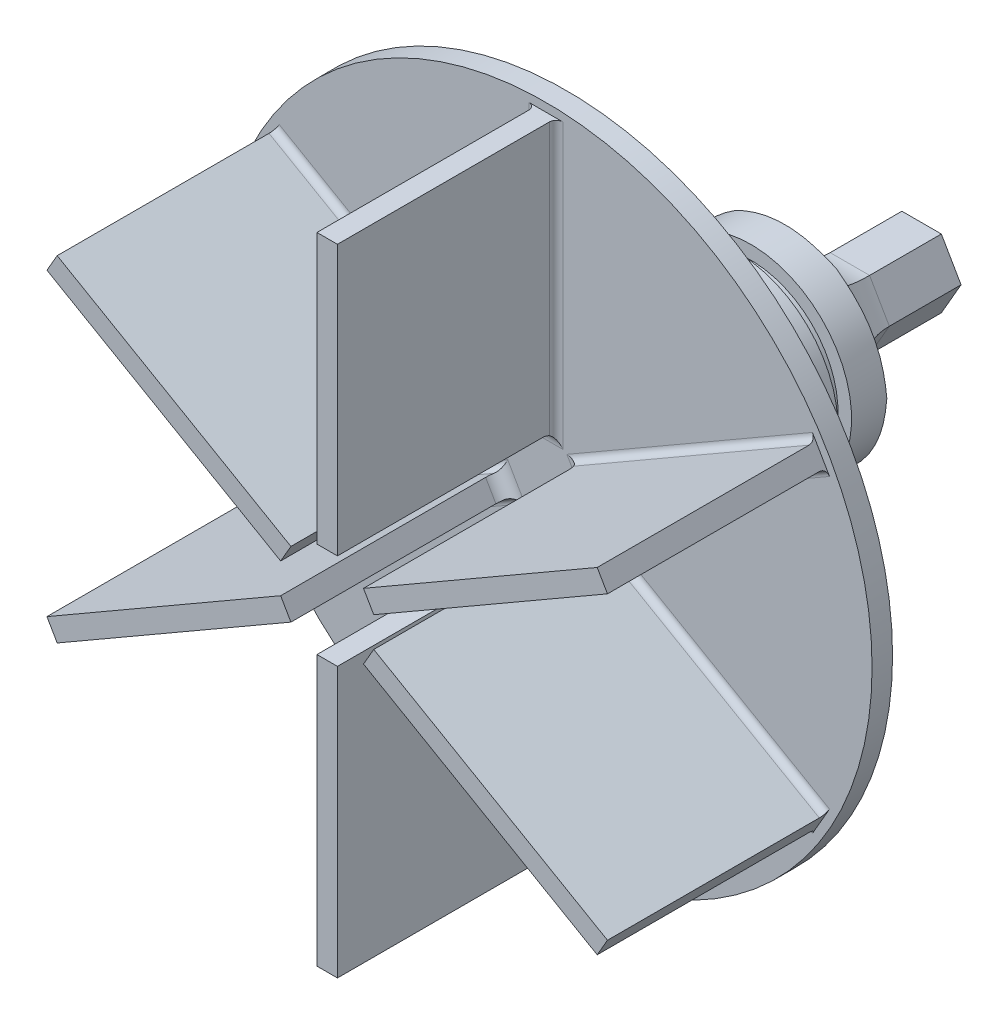
from build123d import *

# Parameters (mm, degrees)
ESBO_O1_R                = 14.75
RESSALTO_EXTRUS_O1_DEPTH = 32
ESBO_O2_R                = 47.75
RESSALTO_EXTRUS_O2_DEPTH = 3
ESBO_O3_W                = 3
ESBO_O3_H                = 39.5
RESSALTO_EXTRUS_O3_DEPTH = 32
FILETE1_R                = 1
FILETE2_R                = 2
ESBO_O4_W                = 2
ESBO_O4_H                = 2
RESSALTO_EXTRUS_O4_DEPTH = 20
FILETE3_R                = 9.5


with BuildPart() as part:
    # Esboço1 → Ressalto-extrusão1 (new body)
    with BuildSketch(Plane.XY):
        Circle(ESBO_O1_R)
    extrude(amount=RESSALTO_EXTRUS_O1_DEPTH)

    # Esboço4 → Corte-Revolução1 (revolve, cut)
    with BuildSketch(Plane(origin=(0, 0, 0), x_dir=(0, 0, -1), z_dir=(1, 0, 0)), mode=Mode.PRIVATE) as corte_revolu_o1_sk:
        with Locations((-6, 13.75)):
            Rectangle(ESBO_O4_W, ESBO_O4_H)
    revolve(corte_revolu_o1_sk.sketch.rotate(Axis((0, 0, 0), (0, 0, 1)), 90), axis=Axis((0, 0, 0), (0, 0, 1)), mode=Mode.SUBTRACT)

    # Esboço5 → Ressalto-extrusão4 (add)
    with BuildSketch(Plane(origin=(0, 0, 0), x_dir=(-1, 0, 0), z_dir=(0, 0, -1))):
        Polygon((5.773502692, 0), (2.886751346, 5), (-2.886751346, 5), (-5.773502692, 0), (-2.886751346, -5), (2.886751346, -5), align=None)
    extrude(amount=RESSALTO_EXTRUS_O4_DEPTH)

    # Filete3
    # the kernel refuses this fillet: 9.5 mm, written as the material it adds along each edge
    with BuildSketch(Plane(origin=(8.988248654, -25.56810334, 0), x_dir=(-0.8660254037844386, -0.5, 0), z_dir=(-0.5, 0.8660254037844387, 0))) as filete3_piece_1_section:
        with BuildLine():
            CenterArc((FILETE3_R, -FILETE3_R), FILETE3_R, 90, 90)
            Line((0, -FILETE3_R), (0, 0))
            Line((0, 0), (FILETE3_R, 0))
        make_face()
    filete3_piece_1 = extrude(amount=53.273502692, mode=Mode.PRIVATE)
    filete3_piece_1 = split(filete3_piece_1, bisect_by=Plane(origin=(-5.234241446, -5, -2.859682806), z_dir=(0, 1, 0)), keep=Keep.TOP, mode=Mode.PRIVATE)
    filete3_piece_1 = split(filete3_piece_1, bisect_by=Plane(origin=(-6.947247742, -2.032986062, -2.859682806), z_dir=(0.8660254037844387, -0.5, 0)), keep=Keep.TOP, mode=Mode.PRIVATE)
    add(filete3_piece_1)
    with BuildSketch(Plane(origin=(8.988248654, -25.56810334, 0), x_dir=(-0.8660254037844386, -0.5, 0), z_dir=(-0.5, 0.8660254037844387, 0))) as filete3_piece_2_section:
        with BuildLine():
            CenterArc((FILETE3_R, -FILETE3_R), FILETE3_R, 90, 90)
            Line((0, -FILETE3_R), (0, 0))
            Line((0, 0), (FILETE3_R, 0))
        make_face()
    filete3_piece_2 = extrude(amount=53.273502692, mode=Mode.PRIVATE)
    filete3_piece_2 = split(filete3_piece_2, bisect_by=Plane(origin=(-10.744786352, -5, -0.059997922), z_dir=(0, -1, 0)), keep=Keep.TOP, mode=Mode.PRIVATE)
    filete3_piece_2 = split(filete3_piece_2, bisect_by=Plane(origin=(-9.702520195, -6.805257939, -0.059997922), z_dir=(-0.8660254037844387, 0.5, 0)), keep=Keep.TOP, mode=Mode.PRIVATE)
    add(filete3_piece_2)
    with BuildSketch(Plane(origin=(-17.648502692, -20.56810334, 0), x_dir=(-0.8660254037844386, 0.4999999999999999, 0), z_dir=(0.5, 0.8660254037844387, 0))) as filete3_piece_3_section:
        with BuildLine():
            CenterArc((FILETE3_R, -FILETE3_R), FILETE3_R, 90, 90)
            Line((0, -FILETE3_R), (0, 0))
            Line((0, 0), (FILETE3_R, 0))
        make_face()
    filete3_piece_3 = extrude(amount=53.273502692, mode=Mode.PRIVATE)
    filete3_piece_3 = split(filete3_piece_3, bisect_by=Plane(origin=(-6.947247742, 2.032986062, -2.859682806), z_dir=(0.8660254037844387, 0.5, 0)), keep=Keep.TOP, mode=Mode.PRIVATE)
    filete3_piece_3 = split(filete3_piece_3, bisect_by=Plane(origin=(-5.234241446, 5, -2.859682806), z_dir=(0, -1, 0)), keep=Keep.TOP, mode=Mode.PRIVATE)
    add(filete3_piece_3)
    with BuildSketch(Plane(origin=(-17.648502692, -20.56810334, 0), x_dir=(-0.8660254037844386, 0.4999999999999999, 0), z_dir=(0.5, 0.8660254037844387, 0))) as filete3_piece_4_section:
        with BuildLine():
            CenterArc((FILETE3_R, -FILETE3_R), FILETE3_R, 90, 90)
            Line((0, -FILETE3_R), (0, 0))
            Line((0, 0), (FILETE3_R, 0))
        make_face()
    filete3_piece_4 = extrude(amount=53.273502692, mode=Mode.PRIVATE)
    filete3_piece_4 = split(filete3_piece_4, bisect_by=Plane(origin=(-9.702520195, 6.805257939, -0.059997922), z_dir=(-0.8660254037844387, -0.5, 0)), keep=Keep.TOP, mode=Mode.PRIVATE)
    filete3_piece_4 = split(filete3_piece_4, bisect_by=Plane(origin=(-10.744786352, 5, -0.059997922), z_dir=(0, 1, 0)), keep=Keep.TOP, mode=Mode.PRIVATE)
    add(filete3_piece_4)
    with BuildSketch(Plane(origin=(-26.636751346, 5, 0), x_dir=(0, 1, 0), z_dir=(1, 0, 0))) as filete3_piece_5_section:
        with BuildLine():
            CenterArc((FILETE3_R, -FILETE3_R), FILETE3_R, 90, 90)
            Line((0, -FILETE3_R), (0, 0))
            Line((0, 0), (FILETE3_R, 0))
        make_face()
    filete3_piece_5 = extrude(amount=53.273502692, mode=Mode.PRIVATE)
    filete3_piece_5 = split(filete3_piece_5, bisect_by=Plane(origin=(1.713006296, 7.032986062, -2.859682806), z_dir=(-0.8660254037844386, -0.5000000000000002, 0)), keep=Keep.TOP, mode=Mode.PRIVATE)
    filete3_piece_5 = split(filete3_piece_5, bisect_by=Plane(origin=(-1.713006296, 7.032986062, -2.859682806), z_dir=(0.8660254037844387, -0.5, 0)), keep=Keep.TOP, mode=Mode.PRIVATE)
    add(filete3_piece_5)
    with BuildSketch(Plane(origin=(-26.636751346, 5, 0), x_dir=(0, 1, 0), z_dir=(1, 0, 0))) as filete3_piece_6_section:
        with BuildLine():
            CenterArc((FILETE3_R, -FILETE3_R), FILETE3_R, 90, 90)
            Line((0, -FILETE3_R), (0, 0))
            Line((0, 0), (FILETE3_R, 0))
        make_face()
    filete3_piece_6 = extrude(amount=53.273502692, mode=Mode.PRIVATE)
    filete3_piece_6 = split(filete3_piece_6, bisect_by=Plane(origin=(-1.042266157, 11.805257939, -0.059997922), z_dir=(0.8660254037844386, 0.5000000000000002, 0)), keep=Keep.TOP, mode=Mode.PRIVATE)
    filete3_piece_6 = split(filete3_piece_6, bisect_by=Plane(origin=(1.042266157, 11.805257939, -0.059997922), z_dir=(-0.8660254037844387, 0.5, 0)), keep=Keep.TOP, mode=Mode.PRIVATE)
    add(filete3_piece_6)
    with BuildSketch(Plane(origin=(-8.988248654, 25.56810334, 0), x_dir=(0.8660254037844384, 0.5000000000000001, 0), z_dir=(0.5000000000000002, -0.8660254037844386, 0))) as filete3_piece_7_section:
        with BuildLine():
            CenterArc((FILETE3_R, -FILETE3_R), FILETE3_R, 90, 90)
            Line((0, -FILETE3_R), (0, 0))
            Line((0, 0), (FILETE3_R, 0))
        make_face()
    filete3_piece_7 = extrude(amount=53.273502692, mode=Mode.PRIVATE)
    filete3_piece_7 = split(filete3_piece_7, bisect_by=Plane(origin=(6.947247742, 2.032986062, -2.859682806), z_dir=(-0.8660254037844387, 0.5, 0)), keep=Keep.TOP, mode=Mode.PRIVATE)
    filete3_piece_7 = split(filete3_piece_7, bisect_by=Plane(origin=(5.234241446, 5, -2.859682806), z_dir=(0, -1, 0)), keep=Keep.TOP, mode=Mode.PRIVATE)
    add(filete3_piece_7)
    with BuildSketch(Plane(origin=(-8.988248654, 25.56810334, 0), x_dir=(0.8660254037844384, 0.5000000000000001, 0), z_dir=(0.5000000000000002, -0.8660254037844386, 0))) as filete3_piece_8_section:
        with BuildLine():
            CenterArc((FILETE3_R, -FILETE3_R), FILETE3_R, 90, 90)
            Line((0, -FILETE3_R), (0, 0))
            Line((0, 0), (FILETE3_R, 0))
        make_face()
    filete3_piece_8 = extrude(amount=53.273502692, mode=Mode.PRIVATE)
    filete3_piece_8 = split(filete3_piece_8, bisect_by=Plane(origin=(9.702520195, 6.805257939, -0.059997922), z_dir=(0.8660254037844387, -0.5, 0)), keep=Keep.TOP, mode=Mode.PRIVATE)
    filete3_piece_8 = split(filete3_piece_8, bisect_by=Plane(origin=(10.744786352, 5, -0.059997922), z_dir=(0, 1, 0)), keep=Keep.TOP, mode=Mode.PRIVATE)
    add(filete3_piece_8)
    with BuildSketch(Plane(origin=(17.648502692, 20.56810334, 0), x_dir=(0.8660254037844386, -0.5, 0), z_dir=(-0.5, -0.8660254037844387, 0))) as filete3_piece_9_section:
        with BuildLine():
            CenterArc((FILETE3_R, -FILETE3_R), FILETE3_R, 90, 90)
            Line((0, -FILETE3_R), (0, 0))
            Line((0, 0), (FILETE3_R, 0))
        make_face()
    filete3_piece_9 = extrude(amount=53.273502692, mode=Mode.PRIVATE)
    filete3_piece_9 = split(filete3_piece_9, bisect_by=Plane(origin=(5.234241446, -5, -2.859682806), z_dir=(0, 1, 0)), keep=Keep.TOP, mode=Mode.PRIVATE)
    filete3_piece_9 = split(filete3_piece_9, bisect_by=Plane(origin=(6.947247742, -2.032986062, -2.859682806), z_dir=(-0.8660254037844386, -0.5000000000000002, 0)), keep=Keep.TOP, mode=Mode.PRIVATE)
    add(filete3_piece_9)
    with BuildSketch(Plane(origin=(17.648502692, 20.56810334, 0), x_dir=(0.8660254037844386, -0.5, 0), z_dir=(-0.5, -0.8660254037844387, 0))) as filete3_piece_10_section:
        with BuildLine():
            CenterArc((FILETE3_R, -FILETE3_R), FILETE3_R, 90, 90)
            Line((0, -FILETE3_R), (0, 0))
            Line((0, 0), (FILETE3_R, 0))
        make_face()
    filete3_piece_10 = extrude(amount=53.273502692, mode=Mode.PRIVATE)
    filete3_piece_10 = split(filete3_piece_10, bisect_by=Plane(origin=(10.744786352, -5, -0.059997922), z_dir=(0, -1, 0)), keep=Keep.TOP, mode=Mode.PRIVATE)
    filete3_piece_10 = split(filete3_piece_10, bisect_by=Plane(origin=(9.702520195, -6.805257939, -0.059997922), z_dir=(0.8660254037844386, 0.5000000000000002, 0)), keep=Keep.TOP, mode=Mode.PRIVATE)
    add(filete3_piece_10)
    with BuildSketch(Plane(origin=(26.636751346, -5, 0), x_dir=(0, -1, 0), z_dir=(-1, 0, 0))) as filete3_piece_11_section:
        with BuildLine():
            CenterArc((FILETE3_R, -FILETE3_R), FILETE3_R, 90, 90)
            Line((0, -FILETE3_R), (0, 0))
            Line((0, 0), (FILETE3_R, 0))
        make_face()
    filete3_piece_11 = extrude(amount=53.273502692, mode=Mode.PRIVATE)
    filete3_piece_11 = split(filete3_piece_11, bisect_by=Plane(origin=(-1.713006296, -7.032986062, -2.859682806), z_dir=(0.8660254037844387, 0.5, 0)), keep=Keep.TOP, mode=Mode.PRIVATE)
    filete3_piece_11 = split(filete3_piece_11, bisect_by=Plane(origin=(1.713006296, -7.032986062, -2.859682806), z_dir=(-0.8660254037844387, 0.5, 0)), keep=Keep.TOP, mode=Mode.PRIVATE)
    add(filete3_piece_11)
    with BuildSketch(Plane(origin=(26.636751346, -5, 0), x_dir=(0, -1, 0), z_dir=(-1, 0, 0))) as filete3_piece_12_section:
        with BuildLine():
            CenterArc((FILETE3_R, -FILETE3_R), FILETE3_R, 90, 90)
            Line((0, -FILETE3_R), (0, 0))
            Line((0, 0), (FILETE3_R, 0))
        make_face()
    filete3_piece_12 = extrude(amount=53.273502692, mode=Mode.PRIVATE)
    filete3_piece_12 = split(filete3_piece_12, bisect_by=Plane(origin=(1.042266157, -11.805257939, -0.059997922), z_dir=(-0.8660254037844387, -0.5, 0)), keep=Keep.TOP, mode=Mode.PRIVATE)
    filete3_piece_12 = split(filete3_piece_12, bisect_by=Plane(origin=(-1.042266157, -11.805257939, -0.059997922), z_dir=(0.8660254037844387, -0.5, 0)), keep=Keep.TOP, mode=Mode.PRIVATE)
    add(filete3_piece_12)
    with BuildSketch(Plane(origin=(8.988248654, -25.56810334, 0), x_dir=(-0.8660254037844386, -0.5, 0), z_dir=(-0.5, 0.8660254037844387, 0))) as filete3_piece_13a_section:
        with BuildLine():
            CenterArc((FILETE3_R, -FILETE3_R), FILETE3_R, 90, 90)
            Line((0, -FILETE3_R), (0, 0))
            Line((0, 0), (FILETE3_R, 0))
        make_face()
    filete3_piece_13a = extrude(amount=53.273502692, mode=Mode.PRIVATE)
    filete3_piece_13a = filete3_piece_13a & Plane(origin=(0, 0, -2.20843227), x_dir=(1, 0, 0), z_dir=(0, 0, -1)) * Cylinder(14.75, 145, mode=Mode.PRIVATE)
    filete3_piece_13a = split(filete3_piece_13a, bisect_by=Plane(origin=(-2.397734967, -5, -2.20843227), z_dir=(0, -1, 0)), keep=Keep.TOP, mode=Mode.PRIVATE)
    filete3_piece_13a = split(filete3_piece_13a, bisect_by=Plane(origin=(-9.188049027, -5.914167737, -2.20843227), z_dir=(0.8660254037844387, -0.5, 0)), keep=Keep.TOP, mode=Mode.PRIVATE)
    with BuildSketch(Plane(origin=(26.636751346, -5, 0), x_dir=(0, -1, 0), z_dir=(-1, 0, 0))) as filete3_piece_13b_section:
        with BuildLine():
            CenterArc((FILETE3_R, -FILETE3_R), FILETE3_R, 90, 90)
            Line((0, -FILETE3_R), (0, 0))
            Line((0, 0), (FILETE3_R, 0))
        make_face()
    filete3_piece_13b = extrude(amount=53.273502692, mode=Mode.PRIVATE)
    filete3_piece_13b = filete3_piece_13b & Plane(origin=(0, 0, -2.208424307), x_dir=(1, 0, 0), z_dir=(0, 0, -1)) * Cylinder(14.75, 145, mode=Mode.PRIVATE)
    filete3_piece_13b = split(filete3_piece_13b, bisect_by=Plane(origin=(-3.131267274, -4.57648599, -2.208424307), z_dir=(-0.8660254037844387, -0.5, 0)), keep=Keep.TOP, mode=Mode.PRIVATE)
    filete3_piece_13b = split(filete3_piece_13b, bisect_by=Plane(origin=(-0.527786364, -10.914152797, -2.208424307), z_dir=(-0.8660254037844387, 0.5, 0)), keep=Keep.TOP, mode=Mode.PRIVATE)
    filete3_piece_13 = filete3_piece_13a & filete3_piece_13b
    add(filete3_piece_13)
    with BuildSketch(Plane(origin=(8.988248654, -25.56810334, 0), x_dir=(-0.8660254037844386, -0.5, 0), z_dir=(-0.5, 0.8660254037844387, 0))) as filete3_piece_14a_section:
        with BuildLine():
            CenterArc((FILETE3_R, -FILETE3_R), FILETE3_R, 90, 90)
            Line((0, -FILETE3_R), (0, 0))
            Line((0, 0), (FILETE3_R, 0))
        make_face()
    filete3_piece_14a = extrude(amount=53.273502692, mode=Mode.PRIVATE)
    filete3_piece_14a = filete3_piece_14a & Plane(origin=(0, 0, -2.208424307), x_dir=(1, 0, 0), z_dir=(0, 0, -1)) * Cylinder(14.75, 145, mode=Mode.PRIVATE)
    filete3_piece_14a = split(filete3_piece_14a, bisect_by=Plane(origin=(-9.715826765, -5, -2.208424307), z_dir=(0, 1, 0)), keep=Keep.TOP, mode=Mode.PRIVATE)
    filete3_piece_14a = split(filete3_piece_14a, bisect_by=Plane(origin=(-5.528986764, 0.42351401, -2.208424307), z_dir=(-0.8660254037844387, 0.5, 0)), keep=Keep.TOP, mode=Mode.PRIVATE)
    with BuildSketch(Plane(origin=(-17.648502692, -20.56810334, 0), x_dir=(-0.8660254037844386, 0.4999999999999999, 0), z_dir=(0.5, 0.8660254037844387, 0))) as filete3_piece_14b_section:
        with BuildLine():
            CenterArc((FILETE3_R, -FILETE3_R), FILETE3_R, 90, 90)
            Line((0, -FILETE3_R), (0, 0))
            Line((0, 0), (FILETE3_R, 0))
        make_face()
    filete3_piece_14b = extrude(amount=53.273502692, mode=Mode.PRIVATE)
    filete3_piece_14b = filete3_piece_14b & Plane(origin=(0, 0, -2.20843227), x_dir=(1, 0, 0), z_dir=(0, 0, -1)) * Cylinder(14.75, 145, mode=Mode.PRIVATE)
    filete3_piece_14b = split(filete3_piece_14b, bisect_by=Plane(origin=(-5.528994503, -0.423500607, -2.20843227), z_dir=(-0.8660254037844387, -0.5, 0)), keep=Keep.TOP, mode=Mode.PRIVATE)
    filete3_piece_14b = split(filete3_piece_14b, bisect_by=Plane(origin=(-9.715844016, 5, -2.20843227), z_dir=(0, -1, 0)), keep=Keep.TOP, mode=Mode.PRIVATE)
    filete3_piece_14 = filete3_piece_14a & filete3_piece_14b
    add(filete3_piece_14)
    with BuildSketch(Plane(origin=(-26.636751346, 5, 0), x_dir=(0, 1, 0), z_dir=(1, 0, 0))) as filete3_piece_15a_section:
        with BuildLine():
            CenterArc((FILETE3_R, -FILETE3_R), FILETE3_R, 90, 90)
            Line((0, -FILETE3_R), (0, 0))
            Line((0, 0), (FILETE3_R, 0))
        make_face()
    filete3_piece_15a = extrude(amount=53.273502692, mode=Mode.PRIVATE)
    filete3_piece_15a = filete3_piece_15a & Plane(origin=(0, 0, -2.20843227), x_dir=(1, 0, 0), z_dir=(0, 0, -1)) * Cylinder(14.75, 145, mode=Mode.PRIVATE)
    filete3_piece_15a = split(filete3_piece_15a, bisect_by=Plane(origin=(-0.527794989, 10.914167737, -2.20843227), z_dir=(-0.8660254037844386, -0.5000000000000002, 0)), keep=Keep.TOP, mode=Mode.PRIVATE)
    filete3_piece_15a = split(filete3_piece_15a, bisect_by=Plane(origin=(-3.131259535, 4.576499393, -2.20843227), z_dir=(-0.8660254037844387, 0.5, 0)), keep=Keep.TOP, mode=Mode.PRIVATE)
    with BuildSketch(Plane(origin=(-17.648502692, -20.56810334, 0), x_dir=(-0.8660254037844386, 0.4999999999999999, 0), z_dir=(0.5, 0.8660254037844387, 0))) as filete3_piece_15b_section:
        with BuildLine():
            CenterArc((FILETE3_R, -FILETE3_R), FILETE3_R, 90, 90)
            Line((0, -FILETE3_R), (0, 0))
            Line((0, 0), (FILETE3_R, 0))
        make_face()
    filete3_piece_15b = extrude(amount=53.273502692, mode=Mode.PRIVATE)
    filete3_piece_15b = filete3_piece_15b & Plane(origin=(0, 0, -2.208424307), x_dir=(1, 0, 0), z_dir=(0, 0, -1)) * Cylinder(14.75, 145, mode=Mode.PRIVATE)
    filete3_piece_15b = split(filete3_piece_15b, bisect_by=Plane(origin=(-9.188040401, 5.914152797, -2.208424307), z_dir=(0.8660254037844387, 0.5, 0)), keep=Keep.TOP, mode=Mode.PRIVATE)
    filete3_piece_15b = split(filete3_piece_15b, bisect_by=Plane(origin=(-2.39771949, 5, -2.208424307), z_dir=(0, 1, 0)), keep=Keep.TOP, mode=Mode.PRIVATE)
    filete3_piece_15 = filete3_piece_15a & filete3_piece_15b
    add(filete3_piece_15)
    with BuildSketch(Plane(origin=(-8.988248654, 25.56810334, 0), x_dir=(0.8660254037844384, 0.5000000000000001, 0), z_dir=(0.5000000000000002, -0.8660254037844386, 0))) as filete3_piece_16a_section:
        with BuildLine():
            CenterArc((FILETE3_R, -FILETE3_R), FILETE3_R, 90, 90)
            Line((0, -FILETE3_R), (0, 0))
            Line((0, 0), (FILETE3_R, 0))
        make_face()
    filete3_piece_16a = extrude(amount=53.273502692, mode=Mode.PRIVATE)
    filete3_piece_16a = filete3_piece_16a & Plane(origin=(0, 0, -2.20843227), x_dir=(1, 0, 0), z_dir=(0, 0, -1)) * Cylinder(14.75, 145, mode=Mode.PRIVATE)
    filete3_piece_16a = split(filete3_piece_16a, bisect_by=Plane(origin=(9.188049027, 5.914167737, -2.20843227), z_dir=(-0.8660254037844387, 0.5, 0)), keep=Keep.TOP, mode=Mode.PRIVATE)
    filete3_piece_16a = split(filete3_piece_16a, bisect_by=Plane(origin=(2.397734967, 5, -2.20843227), z_dir=(0, 1, 0)), keep=Keep.TOP, mode=Mode.PRIVATE)
    with BuildSketch(Plane(origin=(-26.636751346, 5, 0), x_dir=(0, 1, 0), z_dir=(1, 0, 0))) as filete3_piece_16b_section:
        with BuildLine():
            CenterArc((FILETE3_R, -FILETE3_R), FILETE3_R, 90, 90)
            Line((0, -FILETE3_R), (0, 0))
            Line((0, 0), (FILETE3_R, 0))
        make_face()
    filete3_piece_16b = extrude(amount=53.273502692, mode=Mode.PRIVATE)
    filete3_piece_16b = filete3_piece_16b & Plane(origin=(0, 0, -2.208424307), x_dir=(1, 0, 0), z_dir=(0, 0, -1)) * Cylinder(14.75, 145, mode=Mode.PRIVATE)
    filete3_piece_16b = split(filete3_piece_16b, bisect_by=Plane(origin=(3.131267274, 4.57648599, -2.208424307), z_dir=(0.8660254037844386, 0.5000000000000002, 0)), keep=Keep.TOP, mode=Mode.PRIVATE)
    filete3_piece_16b = split(filete3_piece_16b, bisect_by=Plane(origin=(0.527786364, 10.914152797, -2.208424307), z_dir=(0.8660254037844387, -0.5, 0)), keep=Keep.TOP, mode=Mode.PRIVATE)
    filete3_piece_16 = filete3_piece_16a & filete3_piece_16b
    add(filete3_piece_16)
    with BuildSketch(Plane(origin=(17.648502692, 20.56810334, 0), x_dir=(0.8660254037844386, -0.5, 0), z_dir=(-0.5, -0.8660254037844387, 0))) as filete3_piece_17a_section:
        with BuildLine():
            CenterArc((FILETE3_R, -FILETE3_R), FILETE3_R, 90, 90)
            Line((0, -FILETE3_R), (0, 0))
            Line((0, 0), (FILETE3_R, 0))
        make_face()
    filete3_piece_17a = extrude(amount=53.273502692, mode=Mode.PRIVATE)
    filete3_piece_17a = filete3_piece_17a & Plane(origin=(0, 0, -2.208426147), x_dir=(1, 0, 0), z_dir=(0, 0, -1)) * Cylinder(14.75, 145, mode=Mode.PRIVATE)
    filete3_piece_17a = split(filete3_piece_17a, bisect_by=Plane(origin=(9.715829277, -5, -2.208426147), z_dir=(0, 1, 0)), keep=Keep.TOP, mode=Mode.PRIVATE)
    filete3_piece_17a = split(filete3_piece_17a, bisect_by=Plane(origin=(5.528986295, 0.423514822, -2.208426147), z_dir=(0.8660254037844386, 0.5000000000000002, 0)), keep=Keep.TOP, mode=Mode.PRIVATE)
    with BuildSketch(Plane(origin=(-8.988248654, 25.56810334, 0), x_dir=(0.8660254037844384, 0.5000000000000001, 0), z_dir=(0.5000000000000002, -0.8660254037844386, 0))) as filete3_piece_17b_section:
        with BuildLine():
            CenterArc((FILETE3_R, -FILETE3_R), FILETE3_R, 90, 90)
            Line((0, -FILETE3_R), (0, 0))
            Line((0, 0), (FILETE3_R, 0))
        make_face()
    filete3_piece_17b = extrude(amount=53.273502692, mode=Mode.PRIVATE)
    filete3_piece_17b = filete3_piece_17b & Plane(origin=(0, 0, -2.208425825), x_dir=(1, 0, 0), z_dir=(0, 0, -1)) * Cylinder(14.75, 145, mode=Mode.PRIVATE)
    filete3_piece_17b = split(filete3_piece_17b, bisect_by=Plane(origin=(5.528986216, -0.42351496, -2.208425825), z_dir=(0.8660254037844387, -0.5, 0)), keep=Keep.TOP, mode=Mode.PRIVATE)
    filete3_piece_17b = split(filete3_piece_17b, bisect_by=Plane(origin=(9.715824838, 5, -2.208425825), z_dir=(0, -1, 0)), keep=Keep.TOP, mode=Mode.PRIVATE)
    filete3_piece_17 = filete3_piece_17a & filete3_piece_17b
    add(filete3_piece_17)
    with BuildSketch(Plane(origin=(26.636751346, -5, 0), x_dir=(0, -1, 0), z_dir=(-1, 0, 0))) as filete3_piece_18a_section:
        with BuildLine():
            CenterArc((FILETE3_R, -FILETE3_R), FILETE3_R, 90, 90)
            Line((0, -FILETE3_R), (0, 0))
            Line((0, 0), (FILETE3_R, 0))
        make_face()
    filete3_piece_18a = extrude(amount=53.273502692, mode=Mode.PRIVATE)
    filete3_piece_18a = filete3_piece_18a & Plane(origin=(0, 0, -2.20843227), x_dir=(1, 0, 0), z_dir=(0, 0, -1)) * Cylinder(14.75, 145, mode=Mode.PRIVATE)
    filete3_piece_18a = split(filete3_piece_18a, bisect_by=Plane(origin=(0.527794989, -10.914167737, -2.20843227), z_dir=(0.8660254037844387, 0.5, 0)), keep=Keep.TOP, mode=Mode.PRIVATE)
    filete3_piece_18a = split(filete3_piece_18a, bisect_by=Plane(origin=(3.131259535, -4.576499393, -2.20843227), z_dir=(0.8660254037844387, -0.5, 0)), keep=Keep.TOP, mode=Mode.PRIVATE)
    with BuildSketch(Plane(origin=(17.648502692, 20.56810334, 0), x_dir=(0.8660254037844386, -0.5, 0), z_dir=(-0.5, -0.8660254037844387, 0))) as filete3_piece_18b_section:
        with BuildLine():
            CenterArc((FILETE3_R, -FILETE3_R), FILETE3_R, 90, 90)
            Line((0, -FILETE3_R), (0, 0))
            Line((0, 0), (FILETE3_R, 0))
        make_face()
    filete3_piece_18b = extrude(amount=53.273502692, mode=Mode.PRIVATE)
    filete3_piece_18b = filete3_piece_18b & Plane(origin=(0, 0, -2.208424307), x_dir=(1, 0, 0), z_dir=(0, 0, -1)) * Cylinder(14.75, 145, mode=Mode.PRIVATE)
    filete3_piece_18b = split(filete3_piece_18b, bisect_by=Plane(origin=(2.39771949, -5, -2.208424307), z_dir=(0, -1, 0)), keep=Keep.TOP, mode=Mode.PRIVATE)
    filete3_piece_18b = split(filete3_piece_18b, bisect_by=Plane(origin=(9.188040401, -5.914152797, -2.208424307), z_dir=(-0.8660254037844386, -0.5000000000000002, 0)), keep=Keep.TOP, mode=Mode.PRIVATE)
    filete3_piece_18 = filete3_piece_18a & filete3_piece_18b
    add(filete3_piece_18)


with BuildPart() as body_2:
    # Esboço2 → Ressalto-extrusão2 (new body)
    with BuildSketch(Plane.XY.offset(32)):
        Circle(ESBO_O2_R)
    extrude(amount=RESSALTO_EXTRUS_O2_DEPTH)

    # Esboço3 → Ressalto-extrusão3 (add)
    with BuildSketch(Plane.XY.offset(35)):
        with Locations((0, 26.75)):
            Rectangle(ESBO_O3_W, ESBO_O3_H)
        Polygon((39.520181276, 24.549038106), (5.312177826, 4.799038106), (6.812177826, 2.200961894), (41.020181276, 21.950961894), align=None)
        Polygon((41.020181276, -21.950961894), (6.812177826, -2.200961894), (5.312177826, -4.799038106), (39.520181276, -24.549038106), align=None)
        with Locations((0, -26.75)):
            Rectangle(ESBO_O3_W, ESBO_O3_H)
        Polygon((-39.520181276, -24.549038106), (-5.312177826, -4.799038106), (-6.812177826, -2.200961894), (-41.020181276, -21.950961894), align=None)
        Polygon((-41.020181276, 21.950961894), (-6.812177826, 2.200961894), (-5.312177826, 4.799038106), (-39.520181276, 24.549038106), align=None)
    extrude(amount=RESSALTO_EXTRUS_O3_DEPTH)

    # Filete1
    filete1_edges = [body_2.edges().sort_by_distance(p)[0] for p in [
        (23.916179551, 12.075961894, 35),
        (22.416179551, 14.674038106, 35),
        (22.416179551, -14.674038106, 35),
        (23.916179551, -12.075961894, 35),
        (-1.5, -26.75, 35),
        (1.5, -26.75, 35),
        (-23.916179551, -12.075961894, 35),
        (-22.416179551, -14.674038106, 35),
        (-22.416179551, 14.674038106, 35),
        (-23.916179551, 12.075961894, 35),
        (1.5, 26.75, 35),
        (-1.5, 26.75, 35),
    ]]
    fillet(filete1_edges, radius=FILETE1_R)

    # Filete2
    filete2_edges = [body_2.edges().sort_by_distance(p)[0] for p in [
        (0, 7, 35),
        (6.062177826, 3.5, 35),
        (6.062177826, -3.5, 35),
        (0, -7, 35),
        (-6.062177826, -3.5, 35),
        (-6.062177826, 3.5, 35),
    ]]
    fillet(filete2_edges, radius=FILETE2_R)


solid = Compound([part.part, body_2.part])
